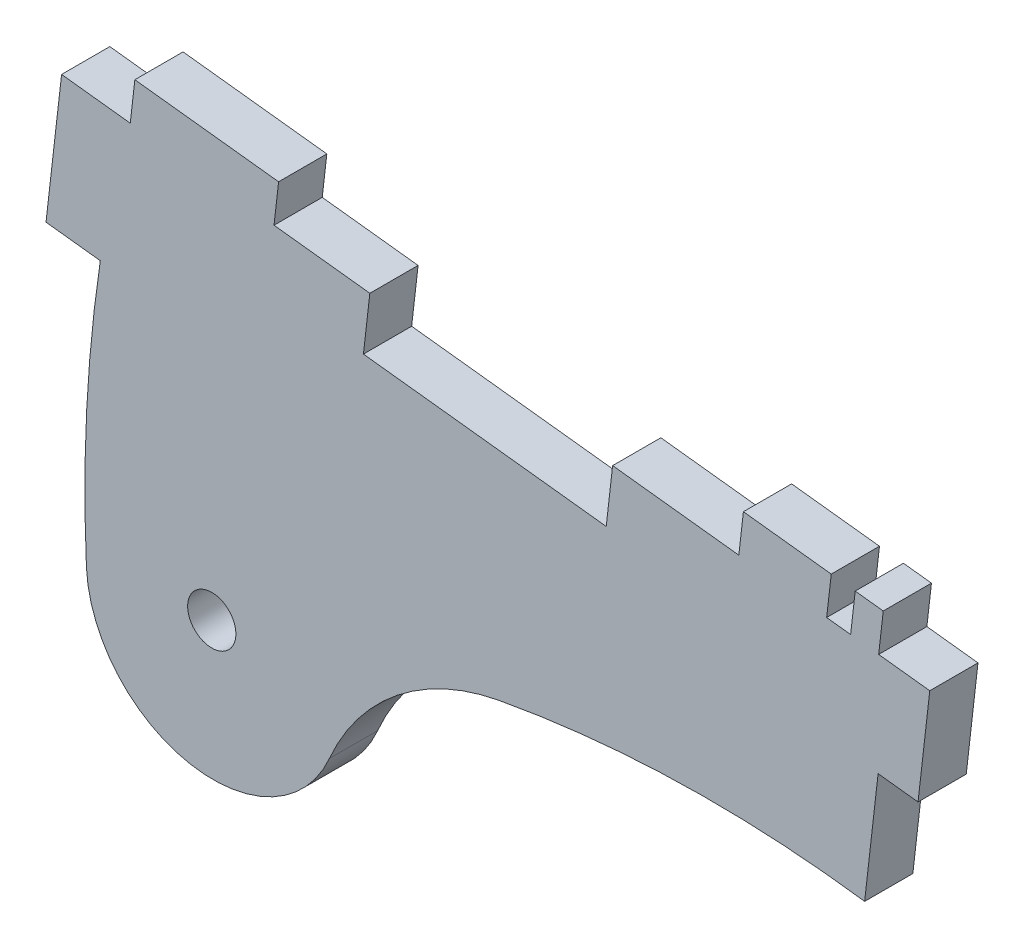
from build123d import *

# Parameters (mm, degrees)
ESQUISSE1_R               = 1.5
T_LE_DE_BASE_PLI_E1_DEPTH = 3


# Sheet-metal steps are written as plain solids
with BuildPart() as part:
    # Esquisse1 → Tôle de base pliée1 (new body)
    with BuildSketch(Plane.XY):
        with BuildLine():
            Line((1154.170302219, 1982.451705153), (1153.201251986, 1974.007124545))
            Line((1153.201251986, 1974.007124545), (1156.579084229, 1973.619504452))
            ThreePointArc((1156.579084229, 1973.619504452), (1155.731717841, 1965.1750361), (1155.715622171, 1956.688174697))
            ThreePointArc((1155.715622171, 1956.688174697), (1162.175892986, 1949.303940909), (1170.827393014, 1953.931419154))
            ThreePointArc((1170.827393014, 1953.931419154), (1175.052398427, 1959.453694764), (1181.379439759, 1962.337225003))
            ThreePointArc((1181.379439759, 1962.337225003), (1192.728026875, 1963.512709412), (1204.119748438, 1962.879564131))
            Line((1204.119748438, 1962.879564131), (1204.957691875, 1970.181642657))
            Line((1204.957691875, 1970.181642657), (1207.441392054, 1969.896627882))
            Line((1207.441392054, 1969.896627882), (1208.171029877, 1976.25490034))
            Line((1208.171029877, 1976.25490034), (1204.991893648, 1976.619719251))
            Line((1204.991893648, 1976.619719251), (1205.276908423, 1979.10341943))
            Line((1205.276908423, 1979.10341943), (1203.533232527, 1979.303513385))
            Line((1203.533232527, 1979.303513385), (1203.248217753, 1976.819813206))
            Line((1203.248217753, 1976.819813206), (1201.757997646, 1976.990822071))
            Line((1201.757997646, 1976.990822071), (1202.04301242, 1979.47452225))
            Line((1202.04301242, 1979.47452225), (1196.578872027, 1980.101554754))
            Line((1196.578872027, 1980.101554754), (1196.293857252, 1977.617854575))
            Line((1196.293857252, 1977.617854575), (1188.445364687, 1978.518501263))
            Line((1188.445364687, 1978.518501263), (1188.046344003, 1975.041321013))
            Line((1188.046344003, 1975.041321013), (1172.945446915, 1976.774210843))
            Line((1172.945446915, 1976.774210843), (1173.3444676, 1980.251391093))
            Line((1173.3444676, 1980.251391093), (1167.383587171, 1980.935426552))
            Line((1167.383587171, 1980.935426552), (1167.668601945, 1983.419126731))
            Line((1167.668601945, 1983.419126731), (1158.727281302, 1984.445179919))
            Line((1158.727281302, 1984.445179919), (1158.442266527, 1981.961479741))
            Line((1158.442266527, 1981.961479741), (1154.170302219, 1982.451705153))
        make_face()
        with Locations((1163.512272203, 1957.725451963)):
            Circle(ESQUISSE1_R, mode=Mode.SUBTRACT)
    extrude(amount=-T_LE_DE_BASE_PLI_E1_DEPTH)


solid = part.part
